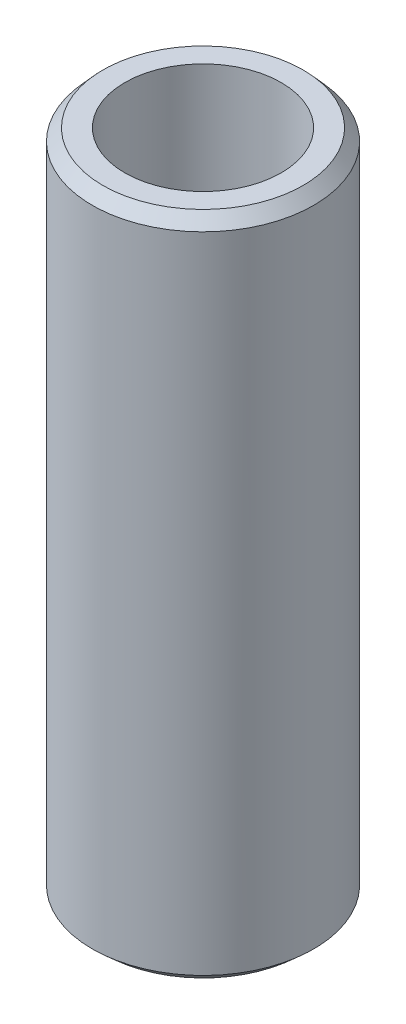
from build123d import *
from OCP.BRepFilletAPI import BRepFilletAPI_MakeChamfer

# Parameters (mm, degrees)
SKETCH1_R           = 20
BOSS_EXTRUDE1_DEPTH = 120.379519564
SKETCH2_R           = 14.13137579
CUT_EXTRUDE1_DEPTH  = 124.65770793
CHAMFER1_SIZE       = 2.147524537
CHAMFER1_SIZE2      = 1.918063389


with BuildPart() as part:
    # Sketch1 → Boss-Extrude1 (new body)
    with BuildSketch(Plane(origin=(0, 0, 0), x_dir=(1, 0, 0), z_dir=(0, 1, 0))):
        Circle(SKETCH1_R)
    extrude(amount=BOSS_EXTRUDE1_DEPTH)

    # Sketch2 → Cut-Extrude1 (cut, through all)
    with BuildSketch(Plane(origin=(0, 0, 0), x_dir=(1, 0, 0), z_dir=(0, 1, 0))):
        Circle(SKETCH2_R)
    extrude(amount=CUT_EXTRUDE1_DEPTH, mode=Mode.SUBTRACT)

    # Chamfer1: one chamfer whose edges measure the first distance from different faces: ONE call of the kernel's chamfer builder (chamfer() names one face for all edges)
    chamfer1_edges_1 = [part.edges().sort_by_distance(p)[0] for p in [
        (-20, 120.379519564, 0),
    ]]
    chamfer1_side_1 = [part.faces().sort_by_distance(p)[0] for p in [
        (-20, 60.189759782, 0),
    ]]
    chamfer1_edges_2 = [part.edges().sort_by_distance(p)[0] for p in [
        (-20, 0, 0),
    ]]
    chamfer1_side_2 = [part.faces().sort_by_distance(p)[0] for p in [
        (-19.434314575, 0, 0),
    ]]
    chamfer1 = BRepFilletAPI_MakeChamfer(part.part.solid().wrapped)
    for e in chamfer1_edges_1:
        chamfer1.Add(CHAMFER1_SIZE, CHAMFER1_SIZE2, e.wrapped, chamfer1_side_1[0].wrapped)  # the first distance lies on this face
    for e in chamfer1_edges_2:
        chamfer1.Add(CHAMFER1_SIZE, CHAMFER1_SIZE2, e.wrapped, chamfer1_side_2[0].wrapped)  # the first distance lies on this face
    add(Compound.cast(chamfer1.Shape()), mode=Mode.REPLACE)


solid = part.part
